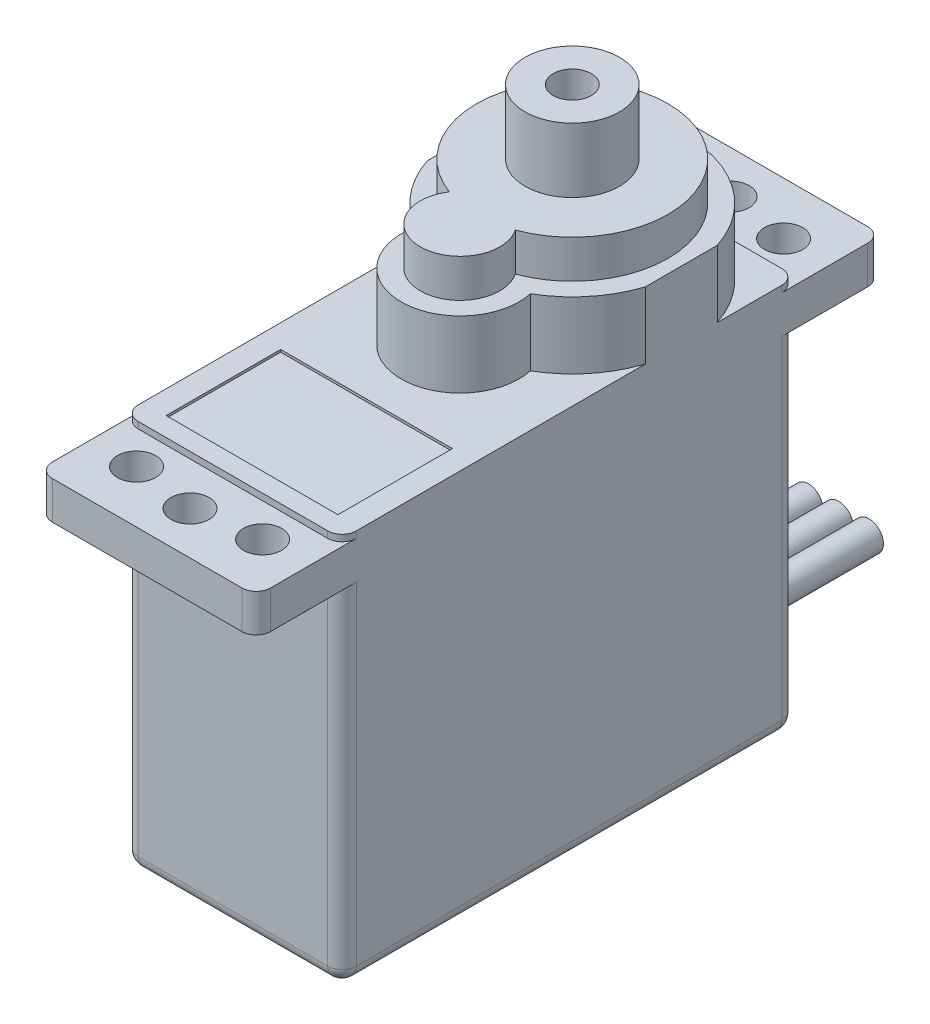
from build123d import *

# Parameters (mm, degrees)
EXTRUDE1_DEPTH      = 5.715
EXTRUDE1_DEPTH_BACK = 5.715
SKETCH1_W           = 23.7998
SKETCH1_H           = 20.5
BOSS_EXTRUDE7_DEPTH = 3.5
BOSS_EXTRUDE8_DEPTH = 2
SKETCH3_W           = 4.4958
SKETCH3_H           = 1.9812
EXTRUDE2_DEPTH      = 11.43
SKETCH4_R           = 0.999998
EXTRUDE3_DEPTH      = 27.604983884
SKETCH5_W           = 6.35
SKETCH5_H           = 4.445
BOSS_EXTRUDE1_DEPTH = 1.5875
SKETCH6_R           = 0.762
BOSS_EXTRUDE4_DEPTH = 6.35
SKETCH8_R           = 2.4765
BOSS_EXTRUDE6_DEPTH = 3.3782
SKETCH9_W           = 9
SKETCH9_H           = 6
CUT_EXTRUDE2_DEPTH  = 0.125
SKETCH11_R          = 1
CUT_EXTRUDE3_DEPTH  = 2
FILLET1_R           = 0.75


with BuildPart() as part:
    # Sketch1 → Extrude1 (new, two sides: drawn at the far end of the back side and taken through both)
    with BuildSketch(Plane(origin=(0, 0, 0), x_dir=(0, 0, -1), z_dir=(1, 0, 0)).offset(-EXTRUDE1_DEPTH_BACK)):
        Rectangle(SKETCH1_W, SKETCH1_H)
    extrude(amount=EXTRUDE1_DEPTH + EXTRUDE1_DEPTH_BACK)

    # Sketch2 → Boss-Extrude7 (add)
    with BuildSketch(Plane(origin=(0, 10.25, 0), x_dir=(-1, 0, 0), z_dir=(0, 1, 0))):
        with BuildLine():
            Line((5.715, -7.771334264), (5.715, -3.988865736))
            ThreePointArc((5.715, -3.988865736), (4.669043342, -2.080359705), (3.012827896, -0.668491793))
            ThreePointArc((3.012827896, -0.668491793), (0, 3.0861), (-3.012827896, -0.668491793))
            ThreePointArc((-3.012827896, -0.668491793), (-4.669043342, -2.080359705), (-5.715, -3.988865736))
            Line((-5.715, -3.988865736), (-5.715, -7.771334264))
            ThreePointArc((-5.715, -7.771334264), (0, -11.8999), (5.715, -7.771334264))
        make_face()
    extrude(amount=BOSS_EXTRUDE7_DEPTH)

    # Sketch10 → Boss-Extrude8 (add)
    with BuildSketch(Plane(origin=(0, 13.75, 0), x_dir=(1, 0, 0), z_dir=(0, 1, 0))):
        with BuildLine():
            ThreePointArc((-1.728861682, 1.167411879), (0, -2.0861), (1.728861682, 1.167411879))
            ThreePointArc((1.728861682, 1.167411879), (0, 10.8999), (-1.728861682, 1.167411879))
        make_face()
    extrude(amount=BOSS_EXTRUDE8_DEPTH)

    # Sketch3 → Extrude2 (add)
    with BuildSketch(Plane(origin=(5.715, 0, 0), x_dir=(0, 0, -1), z_dir=(1, 0, 0))):
        with Locations((-14.1478, 8.9174)):
            Rectangle(SKETCH3_W, SKETCH3_H)
        with Locations((14.1478, 8.9174)):
            Rectangle(SKETCH3_W, SKETCH3_H)
    extrude(amount=-EXTRUDE2_DEPTH)

    # Sketch4 → Extrude3 (cut, through all)
    with BuildSketch(Plane(origin=(0, 9.908, 0), x_dir=(1, 0, 0), z_dir=(0, 1, 0))):
        with Locations(Location((0, 14.15, 0), (0, 0, 270))):
            Circle(SKETCH4_R)
        with Locations(Location((0, -14.15, 0), (0, 0, 270))):
            Circle(SKETCH4_R)
        with Locations(Location((-3.302, 13.65, 0), (0, 0, 270))):
            Circle(SKETCH4_R)
        with Locations(Location((3.302, 13.65, 0), (0, 0, 270))):
            Circle(SKETCH4_R)
        with Locations(Location((3.302, -13.65, 0), (0, 0, 270))):
            Circle(SKETCH4_R)
        with Locations(Location((-3.302, -13.65, 0), (0, 0, 270))):
            Circle(SKETCH4_R)
    extrude(amount=-EXTRUDE3_DEPTH, mode=Mode.SUBTRACT)

    # Sketch5 → Boss-Extrude1 (add)
    with BuildSketch(Plane(origin=(0, 0, -11.8999), x_dir=(-1, 0, 0), z_dir=(0, 0, -1))):
        with Locations((0, -7.5195)):
            Rectangle(SKETCH5_W, SKETCH5_H)
    extrude(amount=BOSS_EXTRUDE1_DEPTH)

    # Sketch6 → Boss-Extrude4 (add)
    with BuildSketch(Plane(origin=(0, 0, -13.4874), x_dir=(-1, 0, 0), z_dir=(0, 0, -1))):
        with Locations(Location((0, -7.5195, 0), (0, 0, 180))):
            Circle(SKETCH6_R)
        with Locations(Location((-1.5875, -7.5195, 0), (0, 0, 180))):
            Circle(SKETCH6_R)
        with Locations(Location((1.5875, -7.5195, 0), (0, 0, 180))):
            Circle(SKETCH6_R)
    extrude(amount=BOSS_EXTRUDE4_DEPTH)

    # Sketch8 → Boss-Extrude6 (add)
    with BuildSketch(Plane(origin=(0, 15.75, 0), x_dir=(1, 0, 0), z_dir=(0, 1, 0))):
        with Locations(Location((0, 5.8801, 0), (0, 0, 270))):
            Circle(SKETCH8_R)
    extrude(amount=BOSS_EXTRUDE6_DEPTH)

    # Sketch9 → Cut-Extrude2 (cut)
    with BuildSketch(Plane(origin=(0, 10.25, 0), x_dir=(1, 0, 0), z_dir=(0, 1, 0))):
        with Locations((0, -7.8999)):
            Rectangle(SKETCH9_W, SKETCH9_H)
    extrude(amount=-CUT_EXTRUDE2_DEPTH, mode=Mode.SUBTRACT)

    # Sketch11 → Cut-Extrude3 (cut)
    with BuildSketch(Plane(origin=(0, 19.1282, 0), x_dir=(1, 0, 0), z_dir=(0, 1, 0))):
        with Locations(Location((0, 5.8801, 0), (0, 0, 270))):
            Circle(SKETCH11_R)
    extrude(amount=-CUT_EXTRUDE3_DEPTH, mode=Mode.SUBTRACT)

    # Fillet1
    # the kernel refuses this fillet: 0.75 mm, written as the material it takes off along each edge
    with BuildSketch(Plane(origin=(-4.965, -9.5, 11.1499), x_dir=(0, -1, 0), z_dir=(-1, 0, 0))) as fillet1_piece_1_section:
        Polygon((0, 0), (FILLET1_R, 0), (FILLET1_R, FILLET1_R), (0, FILLET1_R), align=None)
    fillet1_piece_1 = extrude(amount=FILLET1_R, mode=Mode.PRIVATE)
    fillet1_piece_1 = fillet1_piece_1 - Plane(origin=(-4.965, -9.5, 11.1499), x_dir=(0, 0.7071067811865475, -0.7071067811865475), z_dir=(-1, 0, 0)) * Sphere(FILLET1_R, mode=Mode.PRIVATE)
    add(fillet1_piece_1, mode=Mode.SUBTRACT)
    with BuildSketch(Plane(origin=(-4.965, -9.5, -11.1499), x_dir=(0, 0, -1), z_dir=(-1, 0, 0))) as fillet1_piece_2_section:
        Polygon((0, 0), (FILLET1_R, 0), (FILLET1_R, FILLET1_R), (0, FILLET1_R), align=None)
    fillet1_piece_2 = extrude(amount=FILLET1_R, mode=Mode.PRIVATE)
    fillet1_piece_2 = fillet1_piece_2 - Plane(origin=(-4.965, -9.5, -11.1499), x_dir=(0, 0.7071067811865475, 0.7071067811865475), z_dir=(-1, 0, 0)) * Sphere(FILLET1_R, mode=Mode.PRIVATE)
    add(fillet1_piece_2, mode=Mode.SUBTRACT)
    with BuildSketch(Plane(origin=(4.965, -9.5, 11.1499), x_dir=(0, -1, 0), z_dir=(1, 0, 0))) as fillet1_piece_3_section:
        Polygon((0, 0), (FILLET1_R, 0), (FILLET1_R, -FILLET1_R), (0, -FILLET1_R), align=None)
    fillet1_piece_3 = extrude(amount=FILLET1_R, mode=Mode.PRIVATE)
    fillet1_piece_3 = fillet1_piece_3 - Plane(origin=(4.965, -9.5, 11.1499), x_dir=(0, 0.7071067811865475, -0.7071067811865475), z_dir=(1, 0, 0)) * Sphere(FILLET1_R, mode=Mode.PRIVATE)
    add(fillet1_piece_3, mode=Mode.SUBTRACT)
    with BuildSketch(Plane(origin=(4.965, -9.5, -11.1499), x_dir=(0, 0, -1), z_dir=(1, 0, 0))) as fillet1_piece_4_section:
        Polygon((0, 0), (FILLET1_R, 0), (FILLET1_R, -FILLET1_R), (0, -FILLET1_R), align=None)
    fillet1_piece_4 = extrude(amount=FILLET1_R, mode=Mode.PRIVATE)
    fillet1_piece_4 = fillet1_piece_4 - Plane(origin=(4.965, -9.5, -11.1499), x_dir=(0, 0.7071067811865475, 0.7071067811865475), z_dir=(1, 0, 0)) * Sphere(FILLET1_R, mode=Mode.PRIVATE)
    add(fillet1_piece_4, mode=Mode.SUBTRACT)
    with BuildSketch(Plane(origin=(-5.715, -9.5, 11.8999), x_dir=(0, 0, -1), z_dir=(0, 1, 0)), Plane(origin=(-5.715, 7.9268, -11.8999), x_dir=(0, 0, 1), z_dir=(0, -1, 0))) as fillet1_piece_5:
        with BuildLine():
            CenterArc((FILLET1_R, -FILLET1_R), FILLET1_R, 90, 90)
            Line((0, -FILLET1_R), (0, 0))
            Line((0, 0), (FILLET1_R, 0))
        make_face()
    extrude(amount=17.4268, mode=Mode.SUBTRACT)
    with BuildSketch(Plane(origin=(-5.715, 11.783, -16.3957), x_dir=(0, 0, 1), z_dir=(0, -1, 0)), Plane(origin=(5.715, 11.783, 16.3957), x_dir=(0, 0, -1), z_dir=(0, -1, 0))) as fillet1_piece_6:
        with BuildLine():
            CenterArc((FILLET1_R, -FILLET1_R), FILLET1_R, 90, 90)
            Line((0, -FILLET1_R), (0, 0))
            Line((0, 0), (FILLET1_R, 0))
        make_face()
    extrude(amount=5.7312, mode=Mode.SUBTRACT)
    with BuildSketch(Plane(origin=(5.715, 11.783, -16.3957), x_dir=(0, 0, 1), z_dir=(0, -1, 0)), Plane(origin=(-5.715, 11.783, 16.3957), x_dir=(0, 0, -1), z_dir=(0, -1, 0))) as fillet1_piece_7:
        with BuildLine():
            CenterArc((FILLET1_R, FILLET1_R), FILLET1_R, 180, 90)
            Line((0, FILLET1_R), (0, 0))
            Line((0, 0), (FILLET1_R, 0))
        make_face()
    extrude(amount=5.7312, mode=Mode.SUBTRACT)
    with BuildSketch(Plane(origin=(-5.715, 12.125, -11.8999), x_dir=(0, 0, 1), z_dir=(0, -1, 0)), Plane(origin=(5.715, 9.908, 11.8999), x_dir=(-1, 0, 0), z_dir=(0, 1, 0))) as fillet1_piece_8:
        with BuildLine():
            CenterArc((FILLET1_R, -FILLET1_R), FILLET1_R, 90, 90)
            Line((0, -FILLET1_R), (0, 0))
            Line((0, 0), (FILLET1_R, 0))
        make_face()
    extrude(amount=2.217, mode=Mode.SUBTRACT)
    with BuildSketch(Plane(origin=(5.715, 12.125, -11.8999), x_dir=(0, 0, 1), z_dir=(0, -1, 0)), Plane(origin=(-5.715, 9.908, 11.8999), x_dir=(1, 0, 0), z_dir=(0, 1, 0))) as fillet1_piece_9:
        with BuildLine():
            CenterArc((FILLET1_R, FILLET1_R), FILLET1_R, 180, 90)
            Line((0, FILLET1_R), (0, 0))
            Line((0, 0), (FILLET1_R, 0))
        make_face()
    extrude(amount=2.217, mode=Mode.SUBTRACT)
    with BuildSketch(Plane(origin=(-4.965, -10.25, 11.8999), x_dir=(0, 0, -1), z_dir=(1, 0, 0))) as fillet1_piece_10:
        with BuildLine():
            CenterArc((FILLET1_R, FILLET1_R), FILLET1_R, 180, 90)
            Line((0, FILLET1_R), (0, 0))
            Line((0, 0), (FILLET1_R, 0))
        make_face()
    extrude(amount=9.93, mode=Mode.SUBTRACT)
    with BuildSketch(Plane(origin=(4.965, -10.25, -11.8999), x_dir=(0, 1, 0), z_dir=(-1, 0, 0))) as fillet1_piece_11_section:
        with BuildLine():
            CenterArc((FILLET1_R, -FILLET1_R), FILLET1_R, 90, 90)
            Line((0, -FILLET1_R), (0, 0))
            Line((0, 0), (FILLET1_R, 0))
        make_face()
    fillet1_piece_11 = extrude(amount=9.93, mode=Mode.PRIVATE)
    fillet1_piece_11 = split(fillet1_piece_11, bisect_by=Plane(origin=(4.07, -9.742, -11.898273589), z_dir=(0, 1, 0)), keep=Keep.TOP, mode=Mode.PRIVATE)
    fillet1_piece_11 = split(fillet1_piece_11, bisect_by=Plane(origin=(3.175, -9.649501984, -11.898273589), z_dir=(1, 0, 0)), keep=Keep.TOP, mode=Mode.PRIVATE)
    add(fillet1_piece_11, mode=Mode.SUBTRACT)
    with BuildSketch(Plane(origin=(4.965, -10.25, -11.8999), x_dir=(0, 1, 0), z_dir=(-1, 0, 0))) as fillet1_piece_12_section:
        with BuildLine():
            CenterArc((FILLET1_R, -FILLET1_R), FILLET1_R, 90, 90)
            Line((0, -FILLET1_R), (0, 0))
            Line((0, 0), (FILLET1_R, 0))
        make_face()
    fillet1_piece_12 = extrude(amount=9.93, mode=Mode.PRIVATE)
    fillet1_piece_12 = split(fillet1_piece_12, bisect_by=Plane(origin=(4.07, -9.742, -11.721694977), z_dir=(0, -1, 0)), keep=Keep.TOP, mode=Mode.PRIVATE)
    fillet1_piece_12 = split(fillet1_piece_12, bisect_by=Plane(origin=(3.175, -10.101739238, -11.721694977), z_dir=(1, 0, 0)), keep=Keep.TOP, mode=Mode.PRIVATE)
    add(fillet1_piece_12, mode=Mode.SUBTRACT)
    with BuildSketch(Plane(origin=(4.965, -10.25, -11.8999), x_dir=(0, 1, 0), z_dir=(-1, 0, 0))) as fillet1_piece_13_section:
        with BuildLine():
            CenterArc((FILLET1_R, -FILLET1_R), FILLET1_R, 90, 90)
            Line((0, -FILLET1_R), (0, 0))
            Line((0, 0), (FILLET1_R, 0))
        make_face()
    fillet1_piece_13 = extrude(amount=9.93, mode=Mode.PRIVATE)
    fillet1_piece_13 = split(fillet1_piece_13, bisect_by=Plane(origin=(0, -9.742, -11.721694977), z_dir=(0, -1, 0)), keep=Keep.TOP, mode=Mode.PRIVATE)
    fillet1_piece_13 = split(fillet1_piece_13, bisect_by=Plane(origin=(-3.175, -10.101739238, -11.721694977), z_dir=(1, 0, 0)), keep=Keep.TOP, mode=Mode.PRIVATE)
    fillet1_piece_13 = split(fillet1_piece_13, bisect_by=Plane(origin=(3.175, -10.101739238, -11.721694977), z_dir=(-1, 0, 0)), keep=Keep.TOP, mode=Mode.PRIVATE)
    add(fillet1_piece_13, mode=Mode.SUBTRACT)
    with BuildSketch(Plane(origin=(4.965, -10.25, -11.8999), x_dir=(0, 1, 0), z_dir=(-1, 0, 0))) as fillet1_piece_14_section:
        with BuildLine():
            CenterArc((FILLET1_R, -FILLET1_R), FILLET1_R, 90, 90)
            Line((0, -FILLET1_R), (0, 0))
            Line((0, 0), (FILLET1_R, 0))
        make_face()
    fillet1_piece_14 = extrude(amount=9.93, mode=Mode.PRIVATE)
    fillet1_piece_14 = split(fillet1_piece_14, bisect_by=Plane(origin=(-4.07, -9.742, -11.898273589), z_dir=(0, 1, 0)), keep=Keep.TOP, mode=Mode.PRIVATE)
    fillet1_piece_14 = split(fillet1_piece_14, bisect_by=Plane(origin=(-3.175, -9.649501984, -11.898273589), z_dir=(-1, 0, 0)), keep=Keep.TOP, mode=Mode.PRIVATE)
    add(fillet1_piece_14, mode=Mode.SUBTRACT)
    with BuildSketch(Plane(origin=(4.965, -10.25, -11.8999), x_dir=(0, 1, 0), z_dir=(-1, 0, 0))) as fillet1_piece_15_section:
        with BuildLine():
            CenterArc((FILLET1_R, -FILLET1_R), FILLET1_R, 90, 90)
            Line((0, -FILLET1_R), (0, 0))
            Line((0, 0), (FILLET1_R, 0))
        make_face()
    fillet1_piece_15 = extrude(amount=9.93, mode=Mode.PRIVATE)
    fillet1_piece_15 = split(fillet1_piece_15, bisect_by=Plane(origin=(-4.07, -9.742, -11.721694977), z_dir=(0, -1, 0)), keep=Keep.TOP, mode=Mode.PRIVATE)
    fillet1_piece_15 = split(fillet1_piece_15, bisect_by=Plane(origin=(-3.175, -10.101739238, -11.721694977), z_dir=(-1, 0, 0)), keep=Keep.TOP, mode=Mode.PRIVATE)
    add(fillet1_piece_15, mode=Mode.SUBTRACT)
    with BuildSketch(Plane(origin=(-5.715, -10.25, -11.1499), x_dir=(0, 1, 0), z_dir=(0, 0, 1))) as fillet1_piece_16:
        with BuildLine():
            CenterArc((FILLET1_R, -FILLET1_R), FILLET1_R, 90, 90)
            Line((0, -FILLET1_R), (0, 0))
            Line((0, 0), (FILLET1_R, 0))
        make_face()
    extrude(amount=22.2998, mode=Mode.SUBTRACT)
    with BuildSketch(Plane(origin=(5.715, -9.5, 11.8999), x_dir=(0, 0, -1), z_dir=(0, 1, 0)), Plane(origin=(5.715, 7.9268, -11.8999), x_dir=(0, 0, 1), z_dir=(0, -1, 0))) as fillet1_piece_17:
        with BuildLine():
            CenterArc((FILLET1_R, FILLET1_R), FILLET1_R, 180, 90)
            Line((0, FILLET1_R), (0, 0))
            Line((0, 0), (FILLET1_R, 0))
        make_face()
    extrude(amount=17.4268, mode=Mode.SUBTRACT)
    with BuildSketch(Plane(origin=(5.715, -10.25, -11.1499), x_dir=(0, 1, 0), z_dir=(0, 0, 1))) as fillet1_piece_18:
        with BuildLine():
            CenterArc((FILLET1_R, FILLET1_R), FILLET1_R, 180, 90)
            Line((0, FILLET1_R), (0, 0))
            Line((0, 0), (FILLET1_R, 0))
        make_face()
    extrude(amount=22.2998, mode=Mode.SUBTRACT)


solid = part.part
